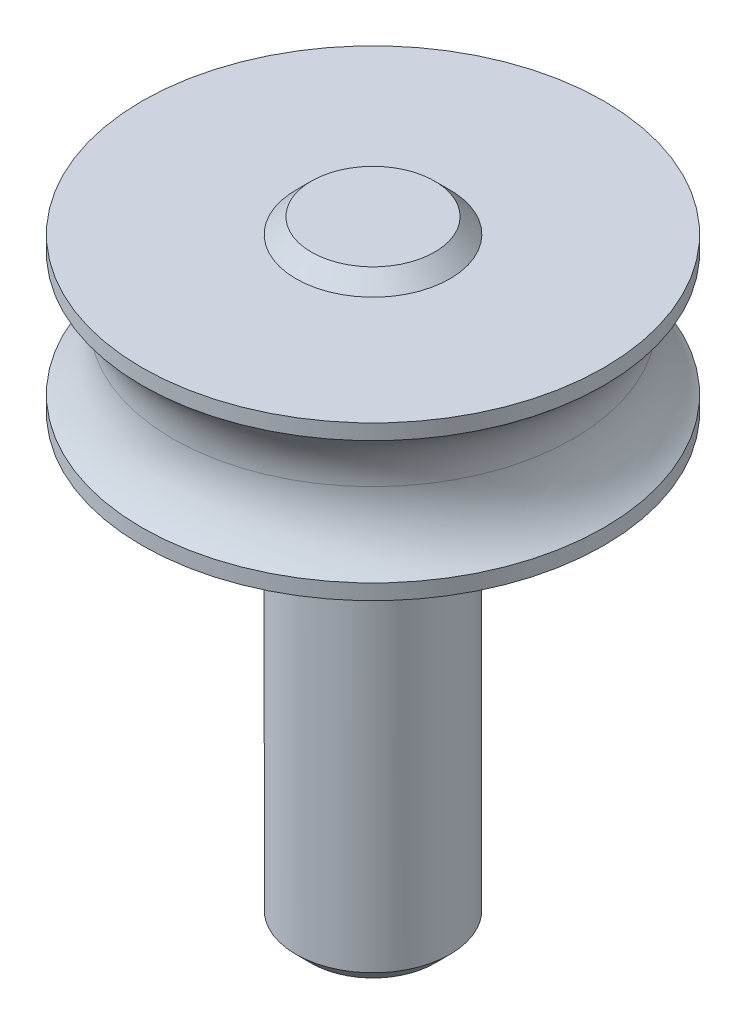
from build123d import *

# Parameters (mm, degrees)
SKETCH1_R               = 5
SKETCH1_R_2             = 2.5
BOSS_EXTRUDE2_DEPTH     = 50
THREAD1_PITCH           = 0.7
CUT_EXTRUDE1_DEPTH      = 50
CUT_EXTRUDE1_DEPTH_BACK = 50
SKETCH9_W               = 10
SKETCH9_H               = 2.255653282
CUT_EXTRUDE2_START      = -10
SKETCH10_R              = 5
SKETCH10_R_2            = 2.5
CUT_EXTRUDE2_DEPTH      = 10
BOSS_EXTRUDE3_START     = -32
SKETCH11_R              = 2.5
BOSS_EXTRUDE3_DEPTH     = 32
CHAMFER1_SIZE           = 1
FILLET1_R               = 5
CHAMFER2_SIZE           = 4


with BuildPart() as part:
    # Sketch1 → Boss-Extrude2 (new body)
    with BuildSketch(Plane(origin=(0, 0, 0), x_dir=(1, 0, 0), z_dir=(0, 1, 0))):
        with Locations(Location((0, 0, 0), (0, 0, 270))):
            Circle(SKETCH1_R)
        with Locations(Location((0, 0, 0), (0, 0, 270))):
            Circle(SKETCH1_R_2, mode=Mode.SUBTRACT)
    extrude(amount=BOSS_EXTRUDE2_DEPTH)

    # Thread1: the profile of Thread Profile2 profile screwed along a right-hand helix of 13.571429 turns, 6 arcs to a turn; built about Z, then put on its axis
    thread1_z = Axis((0, 0, 0), (0, 0, 1))
    thread1_corners = [(2.5003, 0, -0.000173205), (2.5003, 0, 0.612673203), (2.121113887, 0, 0.393749999), (2.121113887, 0, 0.218749999)]
    with BuildLine(mode=Mode.PRIVATE) as thread1_profile:
        Line(thread1_corners[0], thread1_corners[1])
        Line(thread1_corners[1], thread1_corners[2])
        Line(thread1_corners[2], thread1_corners[3])
        Line(thread1_corners[3], thread1_corners[0])
    thread1_cap = Face(thread1_profile.wire())
    thread1_turn_angles = [0, 30, 60, 90, 120, 150, 180, 210, 240, 270, 300, 330, 360]
    thread1_turn_weights = [1, 0.8660254037844387, 1, 0.8660254037844387, 1, 0.8660254037844387, 1, 0.8660254037844387, 1, 0.8660254037844387, 1, 0.8660254037844387, 1]
    thread1_turn_rails = [Edge.make_bspline([Vector(p[0], p[1], 0).rotate(thread1_z, thread1_turn_angles[k]) / thread1_turn_weights[k] + Vector(0, 0, p[2] + THREAD1_PITCH * thread1_turn_angles[k] / 360) for k in range(13)], [0, 0, 0, 1, 1, 2, 2, 3, 3, 4, 4, 5, 5, 6, 6, 6], 2, thread1_turn_weights) for p in thread1_corners]
    thread1_turn_sides = [Face.make_surface_from_curves(thread1_turn_rails[p[0]], thread1_turn_rails[p[1]]) for p in [(0, 1), (1, 2), (2, 3), (3, 0)]]
    thread1_last_angles = [4680, 4710, 4740, 4770, 4800, 4830, 4860, 4872.857142857, 4885.714285714]
    thread1_last_weights = [1, 0.8660254037844387, 1, 0.8660254037844387, 1, 0.8660254037844387, 1, 0.9749279121818226, 1]
    thread1_last_rails = [Edge.make_bspline([Vector(p[0], p[1], 0).rotate(thread1_z, thread1_last_angles[k]) / thread1_last_weights[k] + Vector(0, 0, p[2] + THREAD1_PITCH * thread1_last_angles[k] / 360) for k in range(9)], [0, 0, 0, 1, 1, 2, 2, 3, 3, 4, 4, 4], 2, thread1_last_weights) for p in thread1_corners]
    thread1_last_sides = [Face.make_surface_from_curves(thread1_last_rails[p[0]], thread1_last_rails[p[1]]) for p in [(0, 1), (1, 2), (2, 3), (3, 0)]]
    thread1 = Plane(origin=(0, -0.7, 0), x_dir=(1, 0, 0), z_dir=(0, 1, 0)) * Solid(Shell([*[p.moved(Location((0, 0, THREAD1_PITCH * i))) for i in range(13) for p in thread1_turn_sides], *thread1_last_sides, thread1_cap, thread1_cap.rotate(thread1_z, 4885.714285714).moved(Location((0, 0, THREAD1_PITCH * 4885.714285714 / 360)))]))
    add(thread1)

    # Sketch9 → Cut-Extrude1 (cut, two sides: drawn at the far end of the back side and taken through both)
    with BuildSketch(Plane.XY.offset(-CUT_EXTRUDE1_DEPTH_BACK)):
        with Locations((0, -1.127826641)):
            Rectangle(SKETCH9_W, SKETCH9_H)
    extrude(amount=CUT_EXTRUDE1_DEPTH + CUT_EXTRUDE1_DEPTH_BACK, mode=Mode.SUBTRACT)

    # Sketch10 → Cut-Extrude2 (cut)
    with BuildSketch(Plane(origin=(0, 50, 0), x_dir=(1, 0, 0), z_dir=(0, 1, 0)).offset(CUT_EXTRUDE2_START)):
        with Locations(Location((0, 0, 0), (0, 0, 270))):
            Circle(SKETCH10_R)
        with Locations(Location((0, 0, 0), (0, 0, 44.477513156))):
            Circle(SKETCH10_R_2, mode=Mode.SUBTRACT)
    extrude(amount=CUT_EXTRUDE2_DEPTH, mode=Mode.SUBTRACT)

    # Sketch11 → Boss-Extrude3 (add)
    with BuildSketch(Plane(origin=(0, 40, 0), x_dir=(1, 0, 0), z_dir=(0, 1, 0)).offset(BOSS_EXTRUDE3_START)):
        Circle(SKETCH11_R)
    extrude(amount=BOSS_EXTRUDE3_DEPTH)

    # Chamfer1
    chamfer1_edges = [part.edges().sort_by_distance(p)[0] for p in [
        (0, 0, -5),
        (0, 40, -5),
    ]]
    chamfer(chamfer1_edges, length=CHAMFER1_SIZE)

    # Sketch12 → Revolve1 (revolve)
    with BuildSketch(Plane.XY, mode=Mode.PRIVATE) as revolve1_sk:
        Polygon((0, 29), (0, 39), (-10, 39), (-15, 39), (-15, 38), (-13, 37), (-13, 31), (-15, 30), (-15, 29), (-10, 29), align=None)
    revolve(revolve1_sk.sketch.rotate(Axis((0, 40, 0), (0, -1, 0)), 270), axis=Axis((0, 40, 0), (0, -1, 0)))

    # Fillet1
    # the kernel refuses this fillet: 5 mm, written as the material it adds along each edge
    with BuildSketch(Plane(origin=(0, 31, 0), x_dir=(0, 0, 1), z_dir=(1, 0, 0))) as fillet1_piece_1:
        with BuildLine():
            CenterArc((18, -3), FILLET1_R, 126.869897646, 53.130102354)
            Line((13, -3), (12.9, -3))
            Line((12.9, -3), (12.9, 0))
            Line((12.9, 0), (12.95527864, 0.089442719))
            ThreePointArc((12.95527864, 0.089442719), (13.95527864, 0.589442719), (14.94, 1.08))
            Line((14.94, 1.08), (15, 1))
        make_face()
    revolve(axis=Axis((0, 31, 0), (0, -1, 0)))
    with BuildSketch(Plane(origin=(0, 37, 0), x_dir=(0, 0, 1), z_dir=(1, 0, 0))) as fillet1_piece_2:
        with BuildLine():
            CenterArc((18, 3), FILLET1_R, 180, 53.130102354)
            Line((15, -1), (14.94, -1.08))
            ThreePointArc((14.94, -1.08), (13.95527864, -0.589442719), (12.95527864, -0.089442719))
            Line((12.95527864, -0.089442719), (12.9, 0))
            Line((12.9, 0), (12.9, 3))
            Line((12.9, 3), (13, 3))
        make_face()
    revolve(axis=Axis((0, 37, 0), (0, -1, 0)))

    # Chamfer2
    chamfer2_edges = [part.edges().sort_by_distance(p)[0] for p in [
        (0, 29, -5),
    ]]
    chamfer(chamfer2_edges, length=CHAMFER2_SIZE)


solid = part.part
